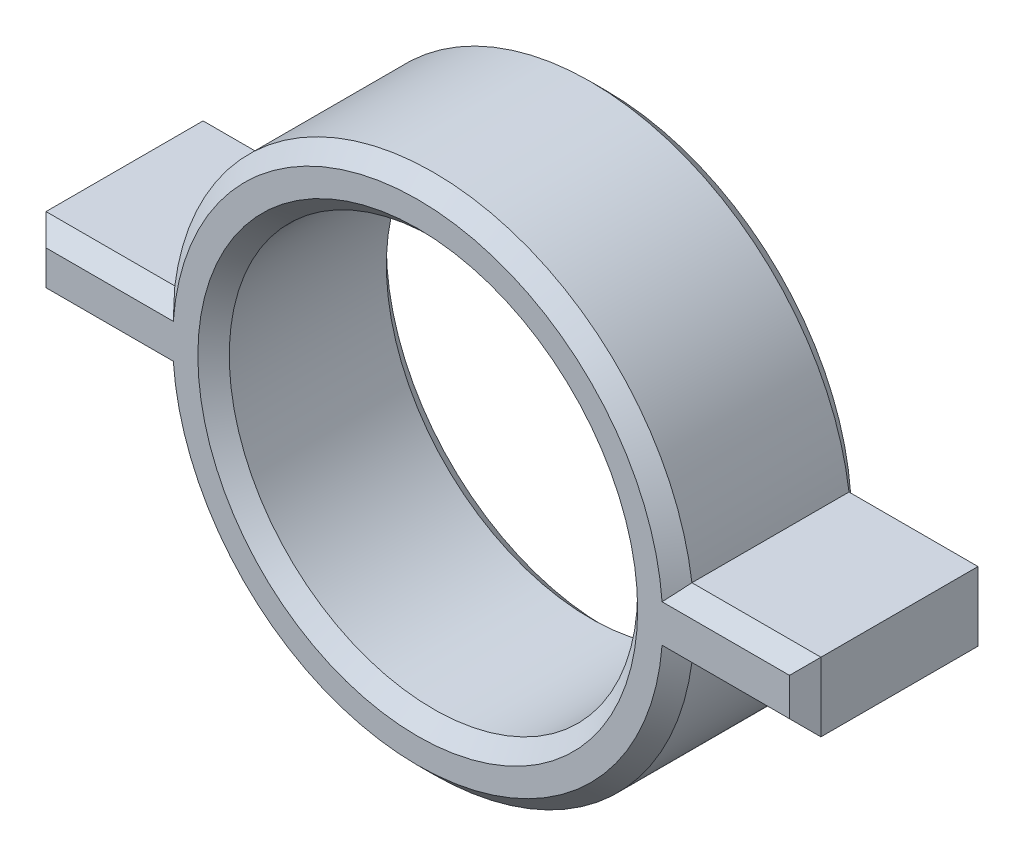
from build123d import *

# Parameters (mm, degrees)
SKETCH1_R           = 6.5
BOSS_EXTRUDE1_DEPTH = 6
CHAMFER1_SIZE       = 0.5


with BuildPart() as part:
    # Sketch1 → Boss-Extrude1 (new body)
    with BuildSketch(Plane.XY):
        with BuildLine():
            Line((8.226982018, -1.098529412), (12.333316464, -1.098529412))
            Line((12.333316464, -1.098529412), (12.333316464, 1.098529412))
            Line((12.333316464, 1.098529412), (8.226982018, 1.098529412))
            ThreePointArc((8.226982018, 1.098529412), (-0.024470538, 8.299963927), (-8.233316464, 1.05))
            Line((-8.233316464, 1.05), (-12.333316464, 1.05))
            Line((-12.333316464, 1.05), (-12.333316464, -1.05))
            Line((-12.333316464, -1.05), (-8.233316464, -1.05))
            ThreePointArc((-8.233316464, -1.05), (-0.024470538, -8.299963927), (8.226982018, -1.098529412))
        make_face()
        Circle(SKETCH1_R, mode=Mode.SUBTRACT)
    extrude(amount=BOSS_EXTRUDE1_DEPTH)

    # Chamfer1
    chamfer1_edges = [part.edges().sort_by_distance(p)[0] for p in [
        (-6.5, 0, 0),
        (-12.333316464, 0, 0),
        (-10.283316464, -1.05, 0),
        (-0.024470538, -8.299963927, 0),
        (10.280149241, -1.098529412, 0),
        (12.333316464, 0, 0),
        (10.280149241, 1.098529412, 0),
        (-0.024470538, 8.299963927, 0),
        (-10.283316464, 1.05, 0),
        (-6.5, 0, 6),
        (-0.024470538, 8.299963927, 6),
        (10.280149241, 1.098529412, 6),
        (12.333316464, 0, 6),
        (10.280149241, -1.098529412, 6),
        (-0.024470538, -8.299963927, 6),
        (-10.283316464, -1.05, 6),
        (-12.333316464, 0, 6),
        (-10.283316464, 1.05, 6),
    ]]
    chamfer(chamfer1_edges, length=CHAMFER1_SIZE)


solid = part.part
